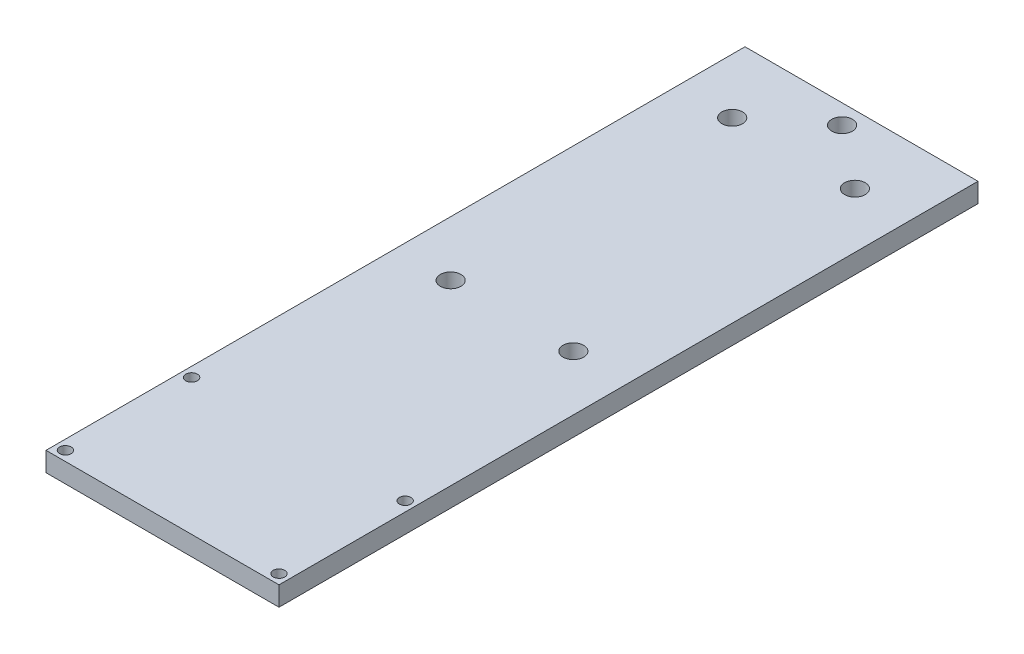
from build123d import *

# Parameters (mm, degrees)
PLATE_SKETCH_W          = 76.2
PLATE_SKETCH_H          = 228.6
PLATE_EXTRUDE_DEPTH     = 6.35
F_1_4_CLEARANCE_HOLE2_D = 6.7564
F_6_CLEARANCE_HOLE1_D   = 3.7973
F_1_4_CLEARANCE_HOLE1_D = 6.7564


with BuildPart() as part:
    # Plate sketch → Plate extrude (new body)
    with BuildSketch(Plane(origin=(0, 0, 0), x_dir=(1, 0, 0), z_dir=(0, 1, 0))):
        Rectangle(PLATE_SKETCH_W, PLATE_SKETCH_H)
    extrude(amount=PLATE_EXTRUDE_DEPTH)

    # 1/4 Clearance Hole2 (through all)
    with Locations(Plane(origin=(0, 6.35, 0), x_dir=(1, 0, 0), z_dir=(0, 1, 0))):
        with Locations((-20.066, 92.075), (20.066, 0), (-20.066, 0), (20.066, 92.075)):
            Hole(F_1_4_CLEARANCE_HOLE2_D / 2)

    # #6 Clearance Hole1 (through all)
    with Locations(Plane(origin=(0, 6.35, 0), x_dir=(1, 0, 0), z_dir=(0, 1, 0))):
        with Locations((-34.925, -69.85), (-34.925, -111.125), (34.925, -69.85), (34.925, -111.125)):
            Hole(F_6_CLEARANCE_HOLE1_D / 2)

    # 1/4 Clearance Hole1 (through all)
    with Locations(Plane(origin=(0, 6.35, 0), x_dir=(1, 0, 0), z_dir=(0, 1, 0))):
        with Locations((0, 107.95)):
            Hole(F_1_4_CLEARANCE_HOLE1_D / 2)


solid = part.part
